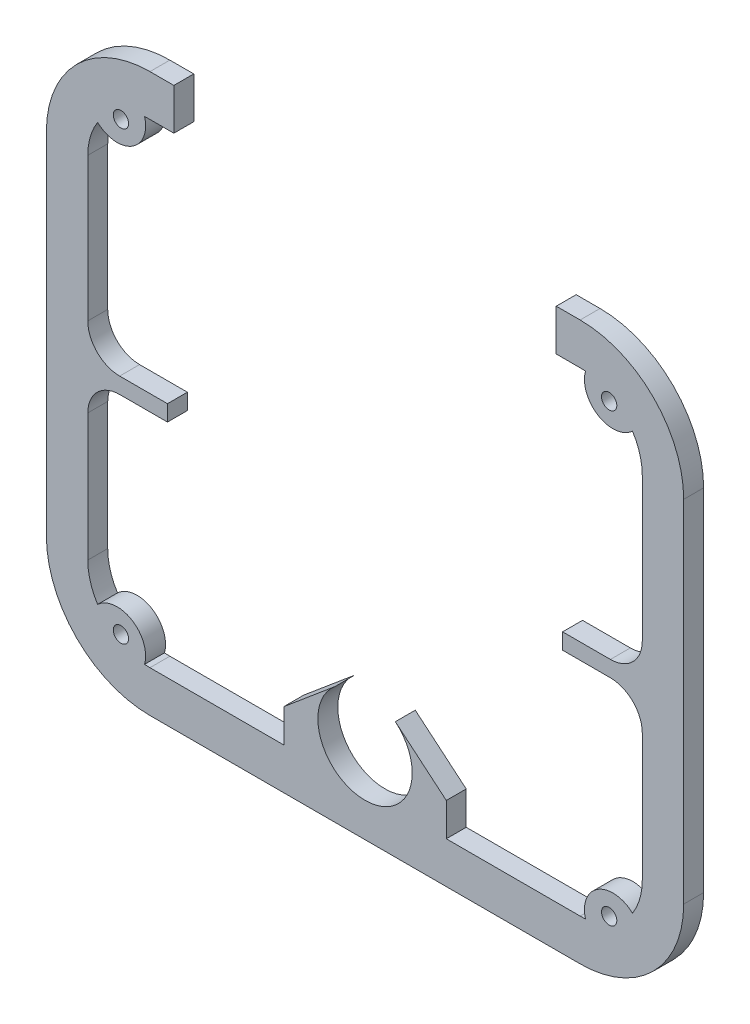
from build123d import *

# Parameters (mm, degrees)
SKETCH1_R           = 0.6096
BOSS_EXTRUDE1_DEPTH = 1.5875
CUT_EXTRUDE1_REACH  = 35.788
SKETCH2_W           = 3.155094666
SKETCH2_H           = 2.647438771
SKETCH2_W_2         = 30.48
SKETCH2_H_2         = 3.302
FILLET1_R           = 2.54


with BuildPart() as part:
    # Sketch1 → Boss-Extrude1 (new body)
    with BuildSketch(Plane.XY):
        with BuildLine():
            ThreePointArc((25.4, 13.97), (22.982166479, 19.807166479), (17.145, 22.225))
            Line((17.145, 22.225), (-17.145, 22.225))
            ThreePointArc((-17.145, 22.225), (-22.982166479, 19.807166479), (-25.4, 13.97))
            Line((-25.4, 13.97), (-25.4, -13.97))
            ThreePointArc((-25.4, -13.97), (-22.982166479, -19.807166479), (-17.145, -22.225))
            Line((-17.145, -22.225), (17.145, -22.225))
            ThreePointArc((17.145, -22.225), (22.982166479, -19.807166479), (25.4, -13.97))
            Line((25.4, -13.97), (25.4, 13.97))
        make_face()
        with Locations((-19.457528855, -17.78)):
            Circle(SKETCH1_R, mode=Mode.SUBTRACT)
        with BuildLine():
            ThreePointArc((-17.571441005, -18.904608097), (-18.58472515, -16.350943325), (-21.316849854, -16.639808568))
            ThreePointArc((-21.316849854, -16.639808568), (-21.898702837, -15.360869633), (-22.098, -13.97))
            Line((-22.098, -13.97), (-22.098, -1.27))
            Line((-22.098, -1.27), (-15.748, -1.27))
            Line((-15.748, -1.27), (-15.748, 0))
            Line((-15.748, 0), (-22.098, 0))
            Line((-22.098, 0), (-22.098, 13.97))
            ThreePointArc((-22.098, 13.97), (-21.898702837, 15.360869633), (-21.316849854, 16.639808568))
            ThreePointArc((-21.316849854, 16.639808568), (-18.58472515, 16.350943325), (-17.571441005, 18.904608097))
            ThreePointArc((-17.571441005, 18.904608097), (-17.358418716, 18.918399888), (-17.145, 18.923))
            Line((-17.145, 18.923), (17.145, 18.923))
            ThreePointArc((17.145, 18.923), (17.358418716, 18.918399888), (17.571441005, 18.904608097))
            ThreePointArc((17.571441005, 18.904608097), (18.58472515, 16.350943325), (21.316849854, 16.639808568))
            ThreePointArc((21.316849854, 16.639808568), (21.898702837, 15.360869633), (22.098, 13.97))
            Line((22.098, 13.97), (22.098, 0))
            Line((22.098, 0), (15.748, 0))
            Line((15.748, 0), (15.748, -1.27))
            Line((15.748, -1.27), (22.098, -1.27))
            Line((22.098, -1.27), (22.098, -13.97))
            ThreePointArc((22.098, -13.97), (21.898702837, -15.360869633), (21.316849854, -16.639808568))
            ThreePointArc((21.316849854, -16.639808568), (18.58472515, -16.350943325), (17.571441005, -18.904608097))
            ThreePointArc((17.571441005, -18.904608097), (17.358418716, -18.918399888), (17.145, -18.923))
            Line((17.145, -18.923), (9.632094666, -18.923))
            Line((9.632094666, -18.923), (2.416367182, -12.868285729))
            ThreePointArc((2.416367182, -12.868285729), (0, -19.5072), (-2.416367182, -12.868285729))
            Line((-2.416367182, -12.868285729), (-9.632094666, -18.923))
            Line((-9.632094666, -18.923), (-17.145, -18.923))
            ThreePointArc((-17.145, -18.923), (-17.358418716, -18.918399888), (-17.571441005, -18.904608097))
        make_face(mode=Mode.SUBTRACT)
        with Locations((19.457528855, -17.78)):
            Circle(SKETCH1_R, mode=Mode.SUBTRACT)
        with Locations((19.457528855, 17.78)):
            Circle(SKETCH1_R, mode=Mode.SUBTRACT)
        with Locations((-19.457528855, 17.78)):
            Circle(SKETCH1_R, mode=Mode.SUBTRACT)
    extrude(amount=BOSS_EXTRUDE1_DEPTH)

    # Sketch2 → Cut-Extrude1 (cut, up to next)
    with BuildSketch(Plane.XY.offset(1.5875), mode=Mode.PRIVATE) as cut_extrude1_sk1:
        with Locations((-8.054547333, -17.599280615)):
            Rectangle(SKETCH2_W, SKETCH2_H)
    cut_extrude1_tool1 = extrude(cut_extrude1_sk1.sketch, amount=-CUT_EXTRUDE1_REACH, mode=Mode.PRIVATE) & part.part
    # Sketch2 → Cut-Extrude1 (cut, up to next)
    with BuildSketch(Plane.XY.offset(1.5875), mode=Mode.PRIVATE) as cut_extrude1_sk2:
        with Locations((8.054547333, -17.599280615)):
            Rectangle(SKETCH2_W, SKETCH2_H)
    cut_extrude1_tool2 = extrude(cut_extrude1_sk2.sketch, amount=-CUT_EXTRUDE1_REACH, mode=Mode.PRIVATE) & part.part
    # Sketch2 → Cut-Extrude1 (cut, up to next)
    with BuildSketch(Plane.XY.offset(1.5875), mode=Mode.PRIVATE) as cut_extrude1_sk3:
        with Locations((0, 20.574)):
            Rectangle(SKETCH2_W_2, SKETCH2_H_2)
    cut_extrude1_tool3 = extrude(cut_extrude1_sk3.sketch, amount=-CUT_EXTRUDE1_REACH, mode=Mode.PRIVATE) & part.part
    add(cut_extrude1_tool1.solids().sort_by_distance((-8.054547, -17.599281, 1.5875))[0], mode=Mode.SUBTRACT)
    add(cut_extrude1_tool2.solids().sort_by_distance((8.054547, -17.599281, 1.5875))[0], mode=Mode.SUBTRACT)
    add(cut_extrude1_tool3.solids().sort_by_distance((0, 20.574, 1.5875))[0], mode=Mode.SUBTRACT)

    # Fillet1
    fillet1_edges = [part.edges().sort_by_distance(p)[0] for p in [
        (22.098, -1.27, 0.79375),
        (22.098, 0, 0.79375),
        (-22.098, 0, 0.79375),
        (-22.098, -1.27, 0.79375),
    ]]
    fillet(fillet1_edges, radius=FILLET1_R)


solid = part.part
